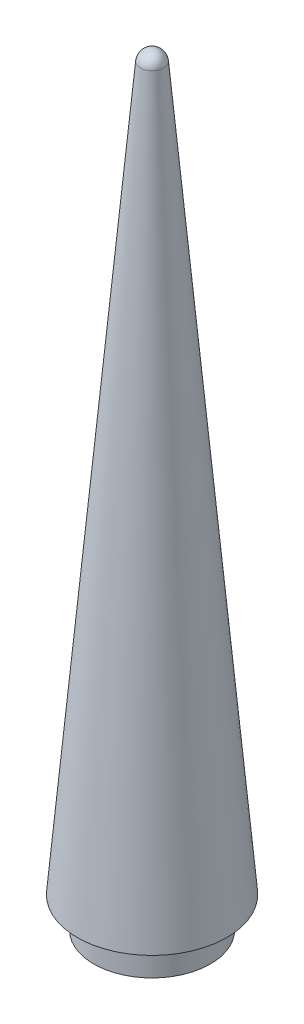
from build123d import *

# Parameters (mm, degrees)
F_1_4_20_TAPPED_HOLE1_D           = 5.1054
F_1_4_20_TAPPED_HOLE1_DEPTH       = 63.5
F_1_4_20_TAPPED_HOLE1_CSINK_D     = 7.62
F_1_4_20_TAPPED_HOLE1_CSINK_ANGLE = 90
F_1_4_20_TAPPED_HOLE1_TIP         = 1.533816902


with BuildPart() as part:
    # Sketch2 → Revolve1 (revolve)
    with BuildSketch(Plane.XY):
        with BuildLine():
            Line((0, 121.620767237), (0, 2.10154956))
            Line((0, 2.10154956), (0, -2.97845044))
            Line((0, -2.97845044), (9.525, -2.97845044))
            Line((9.525, -2.97845044), (9.525, 2.10154956))
            Line((9.525, 2.10154956), (12.202187507, 2.10154956))
            Line((12.202187507, 2.10154956), (1.8977509, 119.881798927))
            ThreePointArc((1.8977509, 119.881798927), (1.286999346, 121.120280564), (0, 121.620767237))
        make_face()
    revolve(axis=Axis((0, 2.10154956, 0), (0, 1, 0)))

    # 1/4-20 Tapped Hole1
    with Locations(Plane.XZ.offset(2.97845044)):
        with Locations((0, 0)):
            CounterSinkHole(F_1_4_20_TAPPED_HOLE1_D / 2, F_1_4_20_TAPPED_HOLE1_CSINK_D / 2, depth=F_1_4_20_TAPPED_HOLE1_DEPTH, counter_sink_angle=F_1_4_20_TAPPED_HOLE1_CSINK_ANGLE)
            with Locations((0, 0, -(F_1_4_20_TAPPED_HOLE1_DEPTH + F_1_4_20_TAPPED_HOLE1_TIP / 2))):  # 118° drill point
                Cone(0, F_1_4_20_TAPPED_HOLE1_D / 2, F_1_4_20_TAPPED_HOLE1_TIP, mode=Mode.SUBTRACT)


solid = part.part
